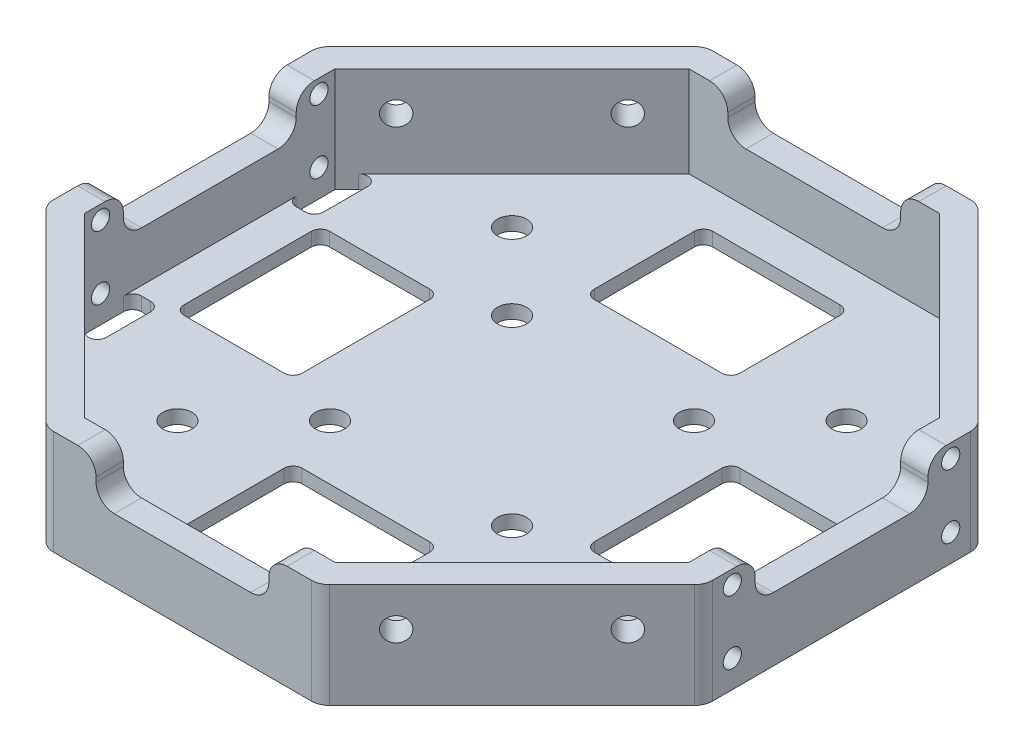
from build123d import *

# Parameters (mm, degrees)
BOSS_EXTRUDE1_DEPTH = 11.5
SHELL1_T            = -3
SKETCH3_R           = 1.3
CUT_EXTRUDE1_DEPTH  = 94
SKETCH4_R           = 1.3
CUT_EXTRUDE2_DEPTH  = 94
FILLET1_R           = 2
CUT_EXTRUDE3_DEPTH  = 79
CUT_EXTRUDE4_DEPTH  = 79
FILLET2_R           = 2
SKETCH7_R           = 1.6
CUT_EXTRUDE5_DEPTH  = 10
SKETCH8_R           = 1
CUT_EXTRUDE7_DEPTH  = 79
CUT_EXTRUDE8_DEPTH  = 1.5
CUT_EXTRUDE9_DEPTH  = 1.5
FILLET3_R           = 1
CUT_EXTRUDE10_DEPTH = 10
FILLET4_R           = 1
SKETCH14_R          = 1.6
CUT_EXTRUDE11_DEPTH = 10


with BuildPart() as part:
    # Sketch1 → Boss-Extrude1 (new body)
    with BuildSketch(Plane(origin=(0, 0, 0), x_dir=(1, 0, 0), z_dir=(0, 1, 0))):
        Polygon((-11.213203436, 40), (18.786796564, 40), (40, 18.786796564), (40, -11.213203436), (18.786796564, -32.426406871), (-11.213203436, -32.426406871), (-32.426406871, -11.213203436), (-32.426406871, 18.786796564), align=None)
    extrude(amount=BOSS_EXTRUDE1_DEPTH)

    # Shell1
    shell1_openings = [part.faces().sort_by_distance(p)[0] for p in [
        (3.786796564, 11.5, -3.786796564),
    ]]
    offset(amount=SHELL1_T, openings=shell1_openings, kind=Kind.INTERSECTION)

    # Sketch3 → Cut-Extrude1 (cut)
    with BuildSketch(Plane(origin=(-21.819805153, 0, 21.819805153), x_dir=(0.7071067811865558, 0, 0.7071067811865392), z_dir=(-0.7071067811865392, 0, 0.7071067811865558))):
        with Locations((-9, 7.25)):
            Circle(SKETCH3_R)
        with Locations((9, 7.25)):
            Circle(SKETCH3_R)
    extrude(amount=-CUT_EXTRUDE1_DEPTH, mode=Mode.SUBTRACT)

    # Sketch4 → Cut-Extrude2 (cut)
    with BuildSketch(Plane(origin=(-25.606601718, 0, -25.606601718), x_dir=(-0.7071067811865556, 0, 0.7071067811865396), z_dir=(-0.7071067811865396, 0, -0.7071067811865556))):
        with Locations((-14.355339059, 7.25)):
            Circle(SKETCH4_R)
        with Locations((3.644660941, 7.25)):
            Circle(SKETCH4_R)
    extrude(amount=-CUT_EXTRUDE2_DEPTH, mode=Mode.SUBTRACT)

    # Fillet1
    fillet1_edges = [part.edges().sort_by_distance(p)[0] for p in [
        (40, 5.75, 11.213203436),
        (18.786796564, 5.75, 32.426406871),
        (40, 5.75, -18.786796564),
        (18.786796564, 5.75, -40),
        (-11.213203436, 5.75, -40),
        (-32.426406871, 5.75, -18.786796564),
        (-32.426406871, 5.75, 11.213203436),
        (-11.213203436, 5.75, 32.426406871),
    ]]
    fillet(fillet1_edges, radius=FILLET1_R)

    # Sketch5 → Cut-Extrude3 (cut)
    with BuildSketch(Plane.XY.offset(32.426406871)):
        Polygon((3.786796564, 7), (13.286796564, 7), (13.286796564, 11.5), (-5.713203436, 11.5), (-5.713203436, 7), align=None)
    extrude(amount=-CUT_EXTRUDE3_DEPTH, mode=Mode.SUBTRACT)

    # Sketch6 → Cut-Extrude4 (cut)
    with BuildSketch(Plane.ZY.offset(32.426406871)):
        Polygon((-3.786796564, 7), (5.713203436, 7), (5.713203436, 11.5), (-13.286796564, 11.5), (-13.286796564, 7), align=None)
    extrude(amount=-CUT_EXTRUDE4_DEPTH, mode=Mode.SUBTRACT)

    # Fillet2
    fillet2_edges = [part.edges().sort_by_distance(p)[0] for p in [
        (38.5, 11.5, 5.713203436),
        (38.5, 7, 5.713203436),
        (38.5, 11.5, -13.286796564),
        (38.5, 7, -13.286796564),
        (13.286796564, 11.5, 30.926406871),
        (13.286796564, 7, 30.926406871),
        (-5.713203436, 11.5, 30.926406871),
        (-5.713203436, 7, 30.926406871),
        (-30.926406871, 11.5, -13.286796564),
        (-30.926406871, 7, -13.286796564),
        (-30.926406871, 11.5, 5.713203436),
        (-30.926406871, 7, 5.713203436),
        (13.286796564, 11.5, -38.5),
        (13.286796564, 7, -38.5),
        (-5.713203436, 11.5, -38.5),
        (-5.713203436, 7, -38.5),
    ]]
    fillet(fillet2_edges, radius=FILLET2_R)

    # Sketch7 → Cut-Extrude5 (cut)
    with BuildSketch(Plane(origin=(0, 0, 0), x_dir=(-1, 0, 0), z_dir=(0, -1, 0))):
        with Locations((6.213203436, -6.213203436)):
            Circle(SKETCH7_R)
        with Locations((-13.786796564, -6.213203436)):
            Circle(SKETCH7_R)
        with Locations((-13.786796564, 13.786796564)):
            Circle(SKETCH7_R)
        with Locations((6.213203436, 13.786796564)):
            Circle(SKETCH7_R)
    extrude(amount=-CUT_EXTRUDE5_DEPTH, mode=Mode.SUBTRACT)

    # Sketch8 → Cut-Extrude7 (cut)
    with BuildSketch(Plane(origin=(40, 0, 0), x_dir=(0, 0, -1), z_dir=(1, 0, 0))):
        with Locations((-8.213203436, 10)):
            Circle(SKETCH8_R)
        with Locations((-8.213203436, 3)):
            Circle(SKETCH8_R)
        with Locations((15.786796564, 3)):
            Circle(SKETCH8_R)
        with Locations((15.786796564, 10)):
            Circle(SKETCH8_R)
    extrude(amount=-CUT_EXTRUDE7_DEPTH, mode=Mode.SUBTRACT)

    # Sketch10 → Cut-Extrude8 (cut)
    with BuildSketch(Plane(origin=(0, 3, 0), x_dir=(1, 0, 0), z_dir=(0, 1, 0))):
        Polygon((17.544155877, 37), (37, 17.544155877), (37, -9.970562748), (17.544155877, -29.426406871), (-9.970562748, -29.426406871), (-29.426406871, -9.970562748), (-29.426406871, 17.544155877), (-9.970562748, 37), align=None)
    extrude(amount=-CUT_EXTRUDE8_DEPTH, mode=Mode.SUBTRACT)

    # Sketch12 → Cut-Extrude9 (cut)
    with BuildSketch(Plane(origin=(0, 1.5, 0), x_dir=(1, 0, 0), z_dir=(0, 1, 0))):
        Polygon((34, 12.286796564), (37, 12.286796564), (37, 17.544155877), (34, 20.544155877), align=None)
        Polygon((37, -9.970562748), (37, -4.713203436), (34, -4.713203436), (34, -12.970562748), align=None)
        Polygon((-26.426406871, -4.713203436), (-29.426406871, -4.713203436), (-29.426406871, -9.970562748), (-26.426406871, -12.970562748), align=None)
        Polygon((-26.426406871, 20.544155877), (-29.426406871, 17.544155877), (-29.426406871, 12.286796564), (-26.426406871, 12.286796564), align=None)
    extrude(amount=-CUT_EXTRUDE9_DEPTH, mode=Mode.SUBTRACT)

    # Fillet3
    fillet3_edges = [part.edges().sort_by_distance(p)[0] for p in [
        (34, 0.75, -12.286796564),
        (34, 0.75, -20.544155877),
        (37, 0.75, -12.286796564),
        (37, 0.75, 4.713203436),
        (34, 0.75, 4.713203436),
        (34, 0.75, 12.970562748),
        (-26.426406871, 0.75, 4.713203436),
        (-26.426406871, 0.75, 12.970562748),
        (-29.426406871, 0.75, 4.713203436),
        (-26.426406871, 0.75, -12.286796564),
        (-29.426406871, 0.75, -12.286796564),
        (-26.426406871, 0.75, -20.544155877),
    ]]
    fillet(fillet3_edges, radius=FILLET3_R)

    # Sketch13 → Cut-Extrude10 (cut)
    with BuildSketch(Plane(origin=(0, 1.5, 0), x_dir=(1, 0, 0), z_dir=(0, 1, 0))):
        Polygon((3.786796564, 19.838268012), (-4.213203436, 19.838268012), (-4.213203436, 32.838268012), (2.581997553, 32.838268012), (11.786796564, 32.838268012), (11.786796564, 19.838268012), align=None)
        Polygon((19.838268012, 3.786796564), (19.838268012, -4.213203436), (32.838268012, -4.213203436), (32.838268012, 4.991595576), (32.838268012, 11.786796564), (19.838268012, 11.786796564), align=None)
        Polygon((3.786796564, -12.264674884), (-4.213203436, -12.264674884), (-4.213203436, -25.264674884), (4.991595576, -25.264674884), (11.786796564, -25.264674884), (11.786796564, -12.264674884), align=None)
        Polygon((-12.264674884, 3.786796564), (-12.264674884, 11.786796564), (-25.264674884, 11.786796564), (-25.264674884, 2.581997553), (-25.264674884, -4.213203436), (-12.264674884, -4.213203436), align=None)
    extrude(amount=-CUT_EXTRUDE10_DEPTH, mode=Mode.SUBTRACT)

    # Fillet4
    fillet4_edges = [part.edges().sort_by_distance(p)[0] for p in [
        (11.786796564, 0.75, 12.264674884),
        (-4.213203436, 0.75, 12.264674884),
        (-4.213203436, 0.75, 25.264674884),
        (11.786796564, 0.75, 25.264674884),
        (32.838268012, 0.75, 4.213203436),
        (19.838268012, 0.75, 4.213203436),
        (19.838268012, 0.75, -11.786796564),
        (32.838268012, 0.75, -11.786796564),
        (11.786796564, 0.75, -19.838268012),
        (11.786796564, 0.75, -32.838268012),
        (-4.213203436, 0.75, -19.838268012),
        (-4.213203436, 0.75, -32.838268012),
        (-12.264674884, 0.75, 4.213203436),
        (-25.264674884, 0.75, 4.213203436),
        (-25.264674884, 0.75, -11.786796564),
        (-12.264674884, 0.75, -11.786796564),
    ]]
    fillet(fillet4_edges, radius=FILLET4_R)

    # Sketch14 → Cut-Extrude11 (cut)
    with BuildSketch(Plane(origin=(0, 1.5, 0), x_dir=(1, 0, 0), z_dir=(0, 1, 0))):
        with Locations((22.171572875, 22.171572875)):
            Circle(SKETCH14_R)
        with Locations((22.171572875, -14.597979746)):
            Circle(SKETCH14_R)
        with Locations((-14.597979746, -14.597979746)):
            Circle(SKETCH14_R)
        with Locations((-14.597979746, 22.171572875)):
            Circle(SKETCH14_R)
    extrude(amount=-CUT_EXTRUDE11_DEPTH, mode=Mode.SUBTRACT)


solid = part.part
